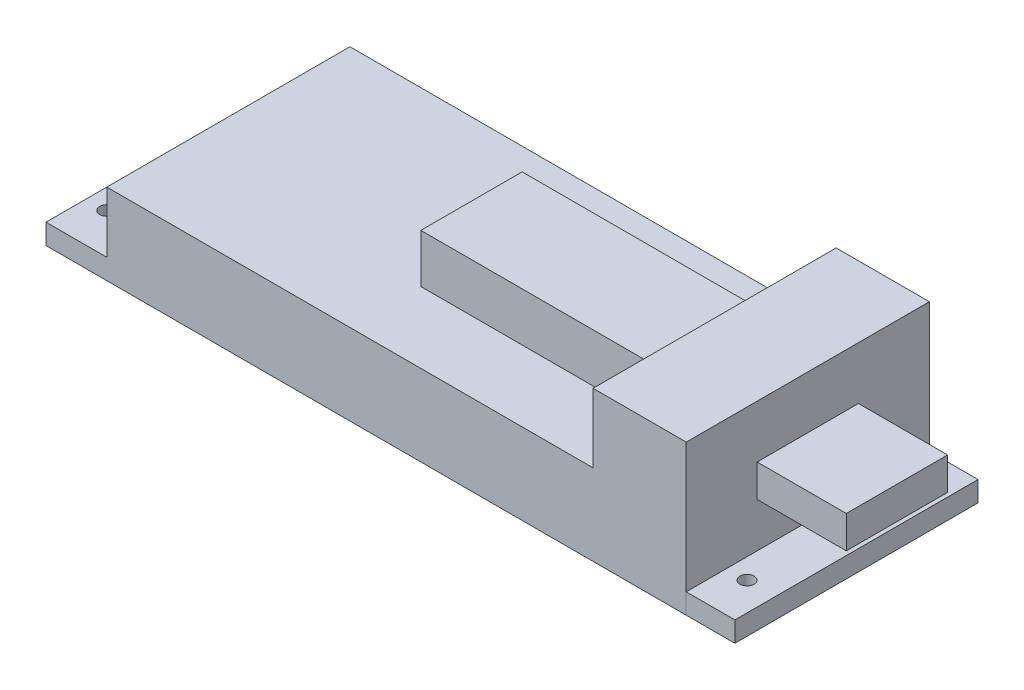
from build123d import *

# Parameters (mm, degrees)
SKETCH1_W             = 15
SKETCH1_H             = 60
SKETCH1_R             = 1.75
BOSS_EXTRUDE1_DEPTH   = 5
SKETCH1_W_2           = 12
BOSS_EXTRUDE1_2_DEPTH = 5
BOSS_EXTRUDE2_DEPTH   = 20
SKETCH1_4_W           = 60
SKETCH1_4_H           = 25
BOSS_EXTRUDE3_DEPTH   = 32
BOSS_EXTRUDE4_DEPTH   = 37
BOSS_EXTRUDE5_START   = 16
SKETCH1_6_W           = 22
SKETCH1_6_H           = 25
BOSS_EXTRUDE5_DEPTH   = 8


with BuildPart() as part:
    # Sketch1 → Boss-Extrude1 (new body)
    with BuildSketch(Plane(origin=(0, 0, 0), x_dir=(1, 0, 0), z_dir=(0, 1, 0))):
        with Locations((-77.5, 0)):
            Rectangle(SKETCH1_W, SKETCH1_H)
        with Locations((-80, -20)):
            Circle(SKETCH1_R, mode=Mode.SUBTRACT)
        with Locations((-80, 20)):
            Circle(SKETCH1_R, mode=Mode.SUBTRACT)
    extrude(amount=BOSS_EXTRUDE1_DEPTH)

    # Sketch1<3> → Boss-Extrude2 (add)
    with BuildSketch(Plane(origin=(0, 0, 0), x_dir=(1, 0, 0), z_dir=(0, 1, 0))):
        Polygon((-70, 30), (-70, -30), (50, -30), (50, -12.5), (-10, -12.5), (-10, 12.5), (50, 12.5), (50, 30), align=None)
    extrude(amount=BOSS_EXTRUDE2_DEPTH)

    # Sketch1<4> → Boss-Extrude3 (add)
    with BuildSketch(Plane(origin=(0, 0, 0), x_dir=(1, 0, 0), z_dir=(0, 1, 0))):
        with Locations((20, 0)):
            Rectangle(SKETCH1_4_W, SKETCH1_4_H)
    extrude(amount=BOSS_EXTRUDE3_DEPTH)

    # Sketch1<5> → Boss-Extrude4 (add)
    with BuildSketch(Plane(origin=(0, 0, 0), x_dir=(1, 0, 0), z_dir=(0, 1, 0))):
        Polygon((50, -12.5), (50, -30), (73, -30), (73, -12.5), (73, 12.5), (73, 30), (50, 30), (50, 12.5), align=None)
    extrude(amount=BOSS_EXTRUDE4_DEPTH)

    # Sketch1<6> → Boss-Extrude5 (add)
    with BuildSketch(Plane(origin=(0, 0, 0), x_dir=(1, 0, 0), z_dir=(0, 1, 0)).offset(BOSS_EXTRUDE5_START)):
        with Locations((84, 0)):
            Rectangle(SKETCH1_6_W, SKETCH1_6_H)
    extrude(amount=BOSS_EXTRUDE5_DEPTH)


with BuildPart() as body_2:
    # Sketch1 → Boss-Extrude1 2 (new body)
    with BuildSketch(Plane(origin=(0, 0, 0), x_dir=(1, 0, 0), z_dir=(0, 1, 0))):
        with Locations((79, 0)):
            Rectangle(SKETCH1_W_2, SKETCH1_H)
        with Locations((78, -20)):
            Circle(SKETCH1_R, mode=Mode.SUBTRACT)
        with Locations((78, 20)):
            Circle(SKETCH1_R, mode=Mode.SUBTRACT)
    extrude(amount=BOSS_EXTRUDE1_2_DEPTH)


solid = Compound([part.part, body_2.part])
